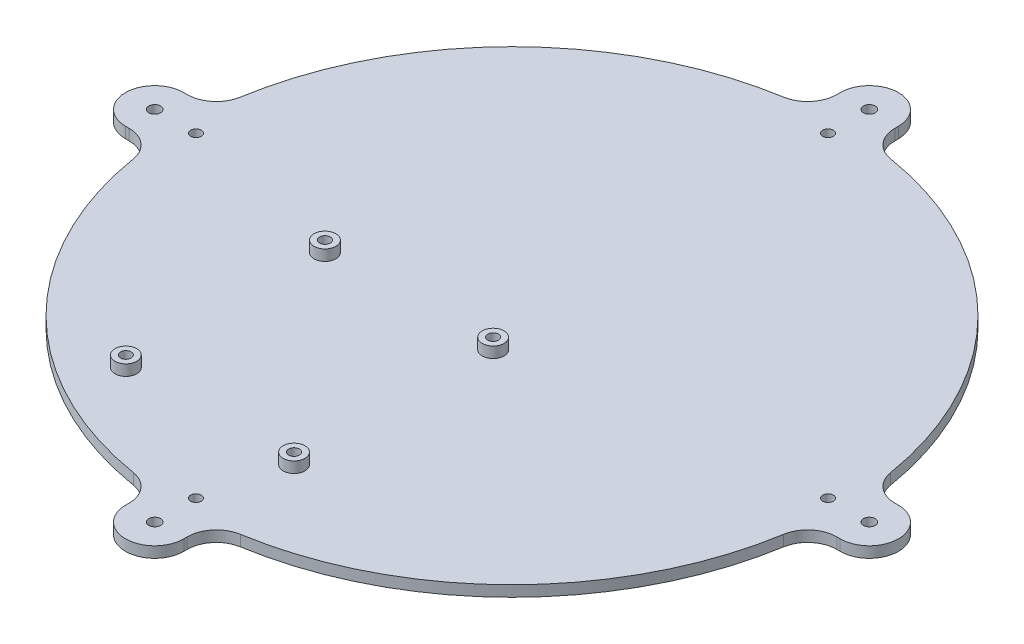
from build123d import *

# Parameters (mm, degrees)
SKETCH1_R                                            = 1.7272
BOSS_EXTRUDE1_DEPTH                                  = 3.175
FILLET2_R                                            = 8.4836
SKETCH2_R                                            = 3.175
BOSS_EXTRUDE2_DEPTH                                  = 3.175
CSK_FOR_M2_5_CROSS_COUNTERSUNK_HEAD_SCRE_D           = 3.1
CSK_FOR_M2_5_CROSS_COUNTERSUNK_HEAD_SCRE_CSINK_D     = 5
CSK_FOR_M2_5_CROSS_COUNTERSUNK_HEAD_SCRE_CSINK_ANGLE = 92
CSK_FOR_M2_5_CROSS_COUNTERSUNK_HEAD_2_D              = 3.1
CSK_FOR_M2_5_CROSS_COUNTERSUNK_HEAD_2_CSINK_D        = 5
CSK_FOR_M2_5_CROSS_COUNTERSUNK_HEAD_2_CSINK_ANGLE    = 92


with BuildPart() as part:
    # Sketch1 → Boss-Extrude1 (new body)
    with BuildSketch(Plane(origin=(0, 0, 0), x_dir=(1, 0, 0), z_dir=(0, 1, 0))):
        with BuildLine():
            Line((-8.4836, 95.624413886), (-8.4836, 104.108013886))
            ThreePointArc((-8.4836, 104.108013886), (0, 112.591613886), (8.4836, 104.108013886))
            Line((8.4836, 104.108013886), (8.4836, 95.624413886))
            ThreePointArc((8.4836, 95.624413886), (67.882250994, 67.882250994), (95.624413886, 8.4836))
            Line((95.624413886, 8.4836), (104.108013886, 8.4836))
            ThreePointArc((104.108013886, 8.4836), (112.591613886, 0), (104.108013886, -8.4836))
            Line((104.108013886, -8.4836), (95.624413886, -8.4836))
            ThreePointArc((95.624413886, -8.4836), (67.882250994, -67.882250994), (8.4836, -95.624413886))
            Line((8.4836, -95.624413886), (8.4836, -104.108013886))
            ThreePointArc((8.4836, -104.108013886), (0, -112.591613886), (-8.4836, -104.108013886))
            Line((-8.4836, -104.108013886), (-8.4836, -95.624413886))
            ThreePointArc((-8.4836, -95.624413886), (-67.882250994, -67.882250994), (-95.624413886, -8.4836))
            Line((-95.624413886, -8.4836), (-104.108013886, -8.4836))
            ThreePointArc((-104.108013886, -8.4836), (-112.591613886, 0), (-104.108013886, 8.4836))
            Line((-104.108013886, 8.4836), (-95.624413886, 8.4836))
            ThreePointArc((-95.624413886, 8.4836), (-67.882250994, 67.882250994), (-8.4836, 95.624413886))
        make_face()
        with Locations((0, 104.108013886)):
            Circle(SKETCH1_R, mode=Mode.SUBTRACT)
        with Locations((104.108013886, 0)):
            Circle(SKETCH1_R, mode=Mode.SUBTRACT)
        with Locations((0, -104.108013886)):
            Circle(SKETCH1_R, mode=Mode.SUBTRACT)
        with Locations((-104.108013886, 0)):
            Circle(SKETCH1_R, mode=Mode.SUBTRACT)
    extrude(amount=BOSS_EXTRUDE1_DEPTH)

    # Fillet2
    fillet2_edges = [part.edges().sort_by_distance(p)[0] for p in [
        (-8.4836, 1.5875, -95.624413886),
        (8.4836, 1.5875, -95.624413886),
        (95.624413886, 1.5875, -8.4836),
        (95.624413886, 1.5875, 8.4836),
        (8.4836, 1.5875, 95.624413886),
        (-8.4836, 1.5875, 95.624413886),
        (-95.624413886, 1.5875, -8.4836),
        (-95.624413886, 1.5875, 8.4836),
    ]]
    fillet(fillet2_edges, radius=FILLET2_R)

    # Sketch2 → Boss-Extrude2 (add)
    with BuildSketch(Plane(origin=(0, 3.175, 0), x_dir=(1, 0, 0), z_dir=(0, 1, 0))):
        with Locations((-43.174257665, -69.325742335)):
            Circle(SKETCH2_R)
        with Locations((-43.174257665, -11.325742335)):
            Circle(SKETCH2_R)
        with Locations((5.825742335, -69.325742335)):
            Circle(SKETCH2_R)
        with Locations((5.825742335, -11.325742335)):
            Circle(SKETCH2_R)
    extrude(amount=BOSS_EXTRUDE2_DEPTH)

    # CSK for M2.5 Cross Countersunk Head Scre (through all)
    with Locations(Plane(origin=(0, 0, 0), x_dir=(-1, 0, 0), z_dir=(0, -1, 0))):
        with Locations((-5.825742335, -11.325742335), (43.174257665, -11.325742335), (43.174257665, -69.325742335), (-5.825742335, -69.325742335)):
            CounterSinkHole(CSK_FOR_M2_5_CROSS_COUNTERSUNK_HEAD_SCRE_D / 2, CSK_FOR_M2_5_CROSS_COUNTERSUNK_HEAD_SCRE_CSINK_D / 2, counter_sink_angle=CSK_FOR_M2_5_CROSS_COUNTERSUNK_HEAD_SCRE_CSINK_ANGLE)

    # CSK for M2.5 Cross Countersunk Head  2 (through all)
    with Locations(Plane(origin=(0, 0, 0), x_dir=(-1, 0, 0), z_dir=(0, -1, 0))):
        with Locations((-92.075, 0), (0, 92.075), (92.075, 0), (0, -92.075)):
            CounterSinkHole(CSK_FOR_M2_5_CROSS_COUNTERSUNK_HEAD_2_D / 2, CSK_FOR_M2_5_CROSS_COUNTERSUNK_HEAD_2_CSINK_D / 2, counter_sink_angle=CSK_FOR_M2_5_CROSS_COUNTERSUNK_HEAD_2_CSINK_ANGLE)


solid = part.part
